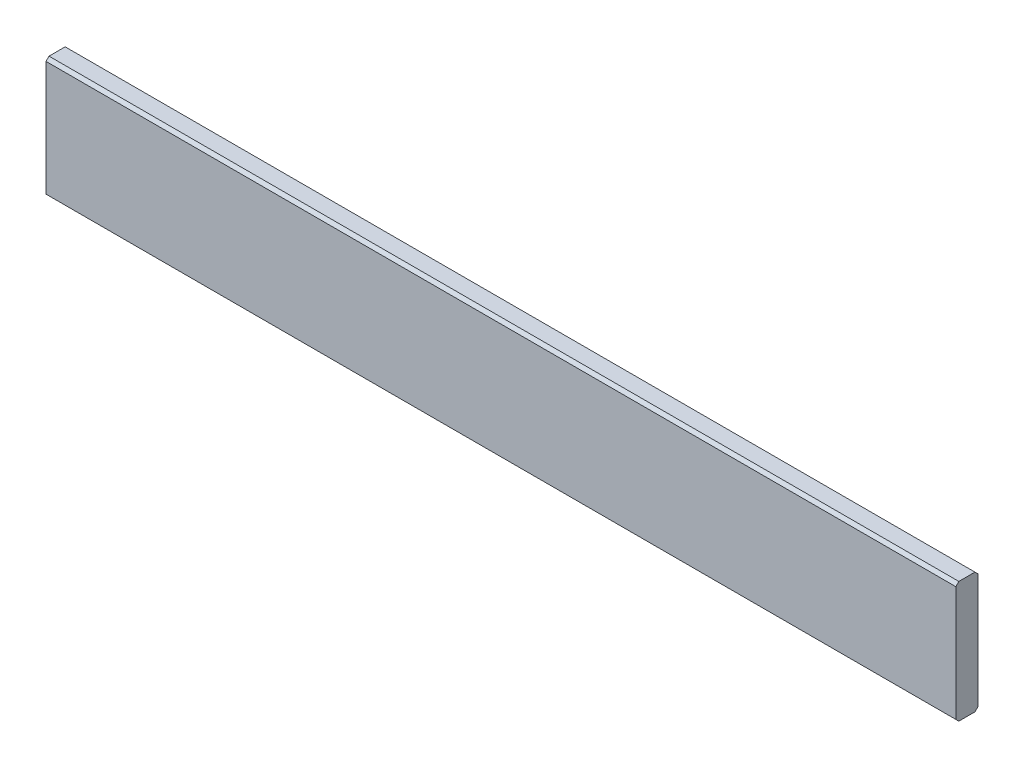
from build123d import *

# Parameters (mm, degrees)
ESQUISSE1_W        = 902
ESQUISSE1_H        = 120
BOSS_EXTRU_1_DEPTH = 22
CHANFREIN1_SIZE    = 3


with BuildPart() as part:
    # Esquisse1 → Boss.-Extru.1 (new body)
    with BuildSketch(Plane.XY):
        with Locations((451, 60)):
            Rectangle(ESQUISSE1_W, ESQUISSE1_H)
    extrude(amount=BOSS_EXTRU_1_DEPTH)

    # Chanfrein1
    chanfrein1_edges = [part.edges().sort_by_distance(p)[0] for p in [
        (451, 0, 0),
        (451, 0, 22),
        (451, 120, 0),
        (451, 120, 22),
    ]]
    chamfer(chanfrein1_edges, length=CHANFREIN1_SIZE)


solid = part.part
